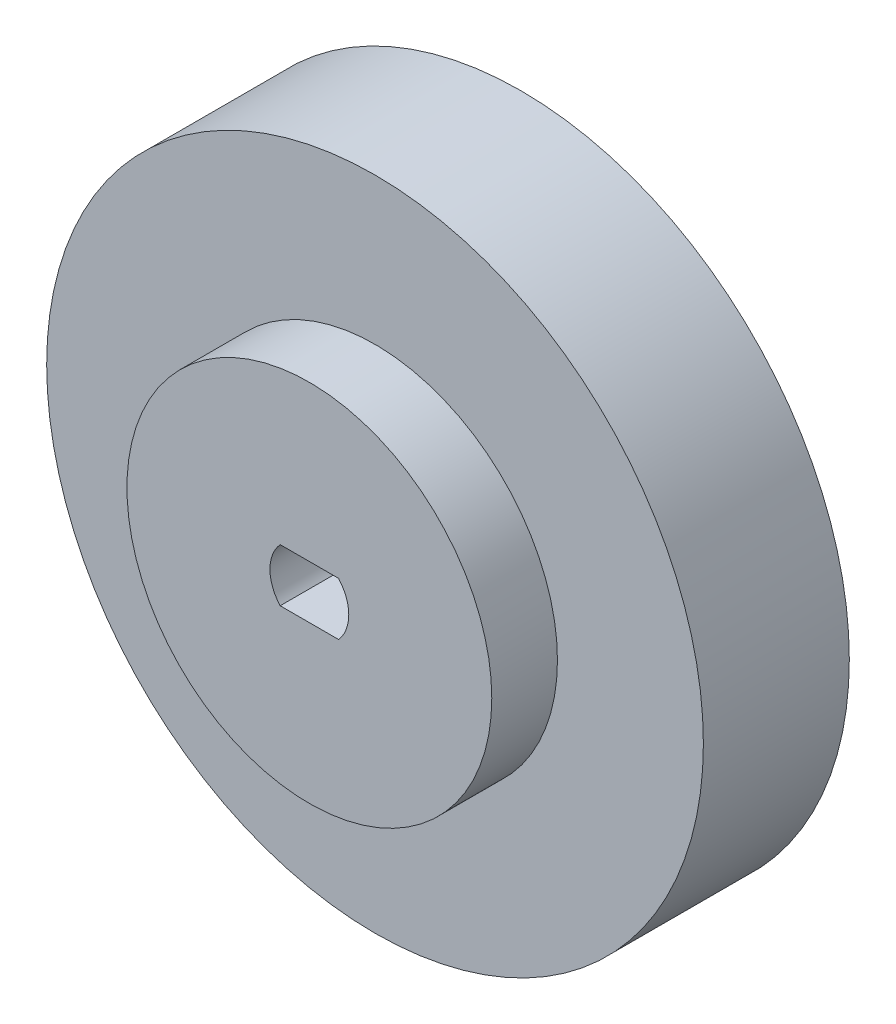
from build123d import *

# Parameters (mm, degrees)
SKETCH1_R           = 12.5
BOSS_EXTRUDE1_DEPTH = 19
BOSS_EXTRUDE2_START = -4.5
SKETCH2_R           = 22.5
BOSS_EXTRUDE2_DEPTH = 10
CUT_EXTRUDE1_DEPTH  = 38.06076092


with BuildPart() as part:
    # Sketch1 → Boss-Extrude1 (new body)
    with BuildSketch(Plane.XY):
        with Locations((0, -0.049046118)):
            Circle(SKETCH1_R)
    extrude(amount=BOSS_EXTRUDE1_DEPTH)

    # Sketch2 → Boss-Extrude2 (add)
    with BuildSketch(Plane.XY.offset(19).offset(BOSS_EXTRUDE2_START)):
        Circle(SKETCH2_R)
    extrude(amount=-BOSS_EXTRUDE2_DEPTH)

    # Sketch3 → Cut-Extrude1 (cut, through all)
    with BuildSketch(Plane.XY.offset(19)):
        with BuildLine():
            Line((-2, 1.813835715), (2, 1.813835715))
            ThreePointArc((2, 1.813835715), (2.7, 0), (2, -1.813835715))
            Line((2, -1.813835715), (-2, -1.813835715))
            ThreePointArc((-2, -1.813835715), (-2.7, 0), (-2, 1.813835715))
        make_face()
    extrude(amount=-CUT_EXTRUDE1_DEPTH, mode=Mode.SUBTRACT)


solid = part.part
